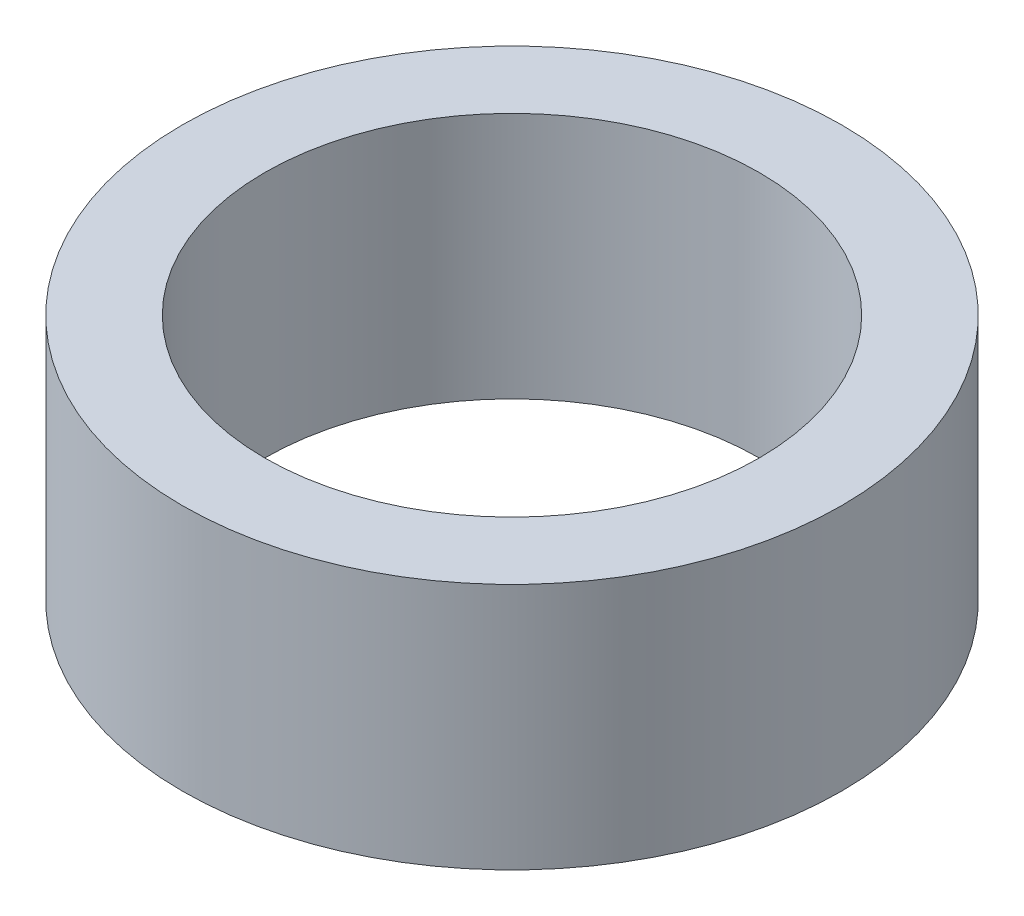
from build123d import *

# Parameters (mm, degrees)
ESQUISSE1_R        = 3
ESQUISSE1_R_2      = 2.25
BOSS_EXTRU_1_DEPTH = 2.25


with BuildPart() as part:
    # Esquisse1 → Boss.-Extru.1 (new body)
    with BuildSketch(Plane(origin=(0, 0, 0), x_dir=(1, 0, 0), z_dir=(0, 1, 0))):
        Circle(ESQUISSE1_R)
        Circle(ESQUISSE1_R_2, mode=Mode.SUBTRACT)
    extrude(amount=BOSS_EXTRU_1_DEPTH)


solid = part.part
